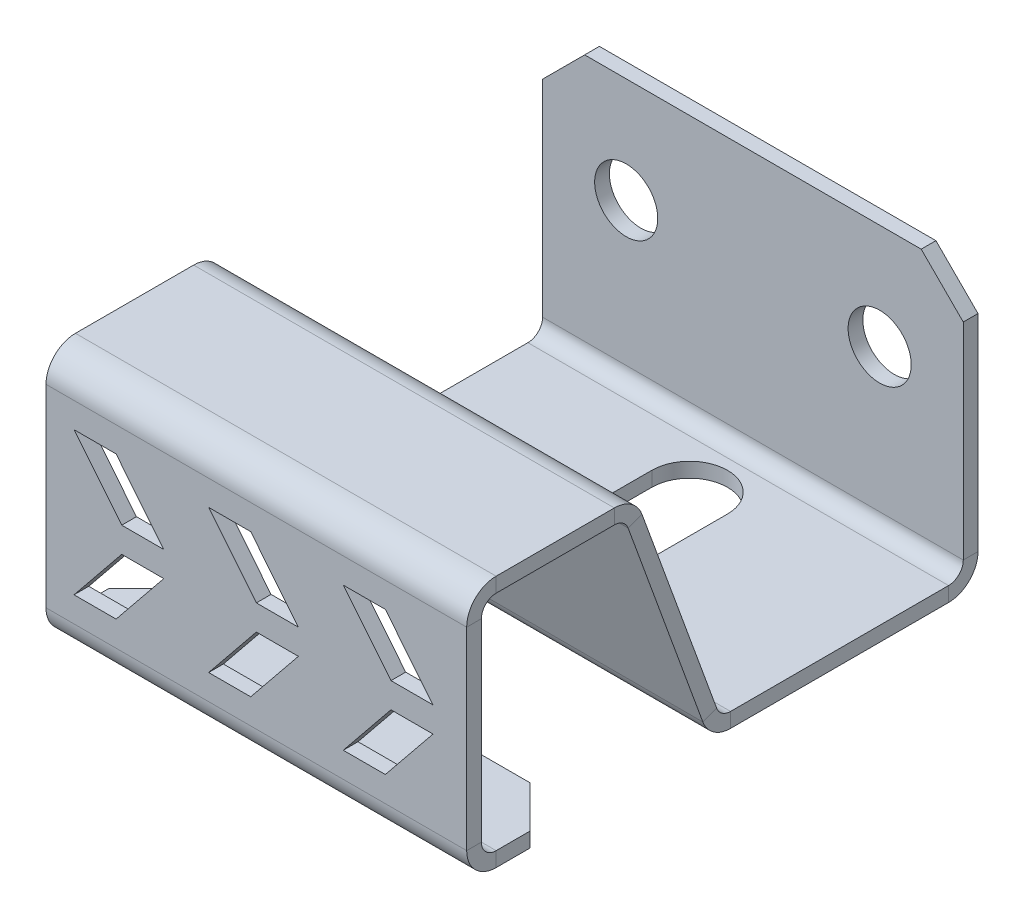
from build123d import *

# Parameters (mm, degrees)
SKETCH1_R                    = 7.5
BASE_FLANGE1_DEPTH           = 3.5
EDGE_FLANGE1_STRIP_W         = 21
EDGE_FLANGE1_STRIP_H         = 3.5
EDGE_FLANGE1_STRIP_CUT_DEPTH = 100
EDGE_FLANGE1_DEPTH           = 100
EDGE_FLANGE2_DEPTH           = 100
EDGE_FLANGE2_2_DEPTH         = 100
EDGE_FLANGE3_DEPTH           = 100
EDGE_FLANGE3_2_DEPTH         = 100
EDGE_FLANGE4_STRIP_W         = 21
EDGE_FLANGE4_STRIP_H         = 3.5
EDGE_FLANGE4_STRIP_CUT_DEPTH = 100
EDGE_FLANGE4_DEPTH           = 100
EDGE_FLANGE5_STRIP_W         = 21
EDGE_FLANGE5_STRIP_H         = 3.5
EDGE_FLANGE5_STRIP_CUT_DEPTH = 100
EDGE_FLANGE5_DEPTH           = 100
BREAK_CORNER1_START          = -0.79936489
BREAK_CORNER1_DEPTH          = 3.5
CUT_EXTRUDE1_DEPTH           = 10
CUT_EXTRUDE2_DEPTH           = 10


# Read off the part's stored shape, not the designer's step: Edge-Flange2, Edge-Flange3, Break-Corner1
# Sheet-metal steps are written as plain solids
with BuildPart() as part:
    # Sketch1 → Base-Flange1 (new body)
    with BuildSketch(Plane.XY):
        Polygon((90, 66), (100, 56), (100, 0), (0, 0), (0, 56), (10, 66), align=None)
        with Locations((19.875, 41)):
            Circle(SKETCH1_R, mode=Mode.SUBTRACT)
        with Locations((80.125, 41)):
            Circle(SKETCH1_R, mode=Mode.SUBTRACT)
    extrude(amount=-BASE_FLANGE1_DEPTH)

    # Edge-Flange1 strip (across the edge) → Edge-Flange1 strip cut (cut)
    with BuildSketch(Plane.YZ):
        with Locations((-3.5, -1.75)):
            Rectangle(EDGE_FLANGE1_STRIP_W, EDGE_FLANGE1_STRIP_H)
    extrude(amount=EDGE_FLANGE1_STRIP_CUT_DEPTH, mode=Mode.SUBTRACT)

    # Edge-Flange1 section (across the edge) → Edge-Flange1 (add)
    with BuildSketch(Plane.YZ):
        with BuildLine():
            Line((0, 3.5), (0, 61.5))
            Line((0, 61.5), (3.5, 61.5))
            Line((3.5, 61.5), (3.5, 3.5))
            ThreePointArc((3.5, 3.5), (4.525126266, 1.025126266), (7, 0))
            Line((7, 0), (7, -3.5))
            ThreePointArc((7, -3.5), (2.050252532, -1.449747468), (0, 3.5))
        make_face()
    extrude(amount=EDGE_FLANGE1_DEPTH)

    # Edge-Flange2 outline → Edge-Flange2 (cut)
    with BuildSketch(Plane.YZ):
        with BuildLine():
            ThreePointArc((0, 55.324651413), (0.937822174, 58.824651413), (3.5, 61.386829239))
            Line((3.5, 61.386829239), (3.5, 61.5))
            Line((3.5, 61.5), (0, 61.5))
            Line((0, 61.5), (0, 55.324651413))
        make_face()
    extrude(amount=EDGE_FLANGE2_DEPTH, mode=Mode.SUBTRACT)

    # Edge-Flange2 2 outline → Edge-Flange2 2 (add)
    with BuildSketch(Plane.YZ):
        with BuildLine():
            Line((59.20063511, 81.77337321), (4.605858997, 61.902499758))
            ThreePointArc((4.605858997, 61.902499758), (4.041672168, 61.668805922), (3.5, 61.386829239))
            Line((3.5, 61.386829239), (3.5, 55.324651413))
            ThreePointArc((3.5, 55.324651413), (4.132967845, 57.33216894), (5.802929498, 58.613575585))
            Line((5.802929498, 58.613575585), (60.397705611, 78.484449037))
            Line((60.397705611, 78.484449037), (59.20063511, 81.77337321))
        make_face()
    extrude(amount=EDGE_FLANGE2_2_DEPTH)

    # Edge-Flange3 outline → Edge-Flange3 (cut)
    with BuildSketch(Plane.YZ):
        with BuildLine():
            Line((59.20063511, 81.77337321), (59.094289381, 81.73466653))
            ThreePointArc((59.094289381, 81.73466653), (57.562946212, 78.450690506), (54.594776113, 76.372355428))
            Line((54.594776113, 76.372355428), (60.397705611, 78.484449037))
            Line((60.397705611, 78.484449037), (59.20063511, 81.77337321))
        make_face()
    extrude(amount=EDGE_FLANGE3_DEPTH, mode=Mode.SUBTRACT)

    # Edge-Flange3 2 outline → Edge-Flange3 2 (add)
    with BuildSketch(Plane.YZ):
        with BuildLine():
            ThreePointArc((59.094289381, 81.73466653), (59.173997997, 82.340113574), (59.20063511, 82.950203773))
            Line((59.20063511, 82.950203773), (59.20063511, 118.048751006))
            Line((59.20063511, 118.048751006), (55.70063511, 118.048751006))
            Line((55.70063511, 118.048751006), (55.70063511, 82.950203773))
            ThreePointArc((55.70063511, 82.950203773), (55.067667265, 80.942686246), (53.397705611, 79.661279601))
            Line((53.397705611, 79.661279601), (59.094289381, 81.73466653))
        make_face()
    extrude(amount=EDGE_FLANGE3_2_DEPTH)

    # Edge-Flange4 strip (across the edge) → Edge-Flange4 strip cut (cut)
    with BuildSketch(Plane(origin=(100, 55.70063511, 118.048751006), x_dir=(0, 0, -1), z_dir=(-1, 0, 0))):
        with Locations((-3.5, -1.75)):
            Rectangle(EDGE_FLANGE4_STRIP_W, EDGE_FLANGE4_STRIP_H)
    extrude(amount=EDGE_FLANGE4_STRIP_CUT_DEPTH, mode=Mode.SUBTRACT)

    # Edge-Flange4 section (across the edge) → Edge-Flange4 (add)
    with BuildSketch(Plane(origin=(100, 55.70063511, 118.048751006), x_dir=(0, 0, -1), z_dir=(-1, 0, 0))):
        with BuildLine():
            Line((0, 3.5), (0, 56.5))
            Line((0, 56.5), (3.5, 56.5))
            Line((3.5, 56.5), (3.5, 3.5))
            ThreePointArc((3.5, 3.5), (4.525126266, 1.025126266), (7, 0))
            Line((7, 0), (7, -3.5))
            ThreePointArc((7, -3.5), (2.050252532, -1.449747468), (0, 3.5))
        make_face()
    extrude(amount=EDGE_FLANGE4_DEPTH)

    # Edge-Flange5 strip (across the edge) → Edge-Flange5 strip cut (cut)
    with BuildSketch(Plane(origin=(100, -0.79936489, 114.548751006), x_dir=(0, 1, 0), z_dir=(-1, 0, 0))):
        with Locations((-3.5, -1.75)):
            Rectangle(EDGE_FLANGE5_STRIP_W, EDGE_FLANGE5_STRIP_H)
    extrude(amount=EDGE_FLANGE5_STRIP_CUT_DEPTH, mode=Mode.SUBTRACT)

    # Edge-Flange5 section (across the edge) → Edge-Flange5 (add)
    with BuildSketch(Plane(origin=(100, -0.79936489, 114.548751006), x_dir=(0, 1, 0), z_dir=(-1, 0, 0))):
        with BuildLine():
            Line((0, 3.5), (0, 21.5))
            Line((0, 21.5), (3.5, 21.5))
            Line((3.5, 21.5), (3.5, 3.5))
            ThreePointArc((3.5, 3.5), (4.525126266, 1.025126266), (7, 0))
            Line((7, 0), (7, -3.5))
            ThreePointArc((7, -3.5), (2.050252532, -1.449747468), (0, 3.5))
        make_face()
    extrude(amount=EDGE_FLANGE5_DEPTH)

    # Break-Corner1 outline → Break-Corner1 (cut)
    with BuildSketch(Plane(origin=(0, 0, 0), x_dir=(1, 0, 0), z_dir=(0, 1, 0)).offset(BREAK_CORNER1_START)):
        Polygon((100, -93.048751006), (90, -93.048751006), (100, -103.048751006), align=None)
        Polygon((0, -103.048751006), (10, -93.048751006), (0, -93.048751006), align=None)
    extrude(amount=BREAK_CORNER1_DEPTH, mode=Mode.SUBTRACT)

    # Sketch24 → Cut-Extrude1 (cut)
    with BuildSketch(Plane.XY.offset(118.048751006)):
        Polygon((70.663023535, 46.20063511), (80.663023535, 46.20063511), (92, 32.20063511), (82, 32.20063511), align=None)
        Polygon((38.663023535, 46.20063511), (48.663023535, 46.20063511), (60, 32.20063511), (50, 32.20063511), align=None)
        Polygon((6.663023535, 46.20063511), (16.663023535, 46.20063511), (28, 32.20063511), (18, 32.20063511), align=None)
        Polygon((18, 26.20063511), (6.663023535, 12.20063511), (16.663023535, 12.20063511), (28, 26.20063511), align=None)
        Polygon((50, 26.20063511), (38.663023535, 12.20063511), (48.663023535, 12.20063511), (60, 26.20063511), align=None)
        Polygon((82, 26.20063511), (70.663023535, 12.20063511), (80.663023535, 12.20063511), (92, 26.20063511), align=None)
    extrude(amount=-CUT_EXTRUDE1_DEPTH, mode=Mode.SUBTRACT)

    # Sketch25 → Cut-Extrude2 (cut)
    with BuildSketch(Plane(origin=(0, 3.5, 0), x_dir=(1, 0, 0), z_dir=(0, 1, 0))):
        with BuildLine():
            Line((41, -45.048751006), (41, -15.048751006))
            ThreePointArc((41, -15.048751006), (50, -6.048751006), (59, -15.048751006))
            Line((59, -15.048751006), (59, -45.048751006))
            ThreePointArc((59, -45.048751006), (50, -54.048751006), (41, -45.048751006))
        make_face()
    extrude(amount=-CUT_EXTRUDE2_DEPTH, mode=Mode.SUBTRACT)


solid = part.part
